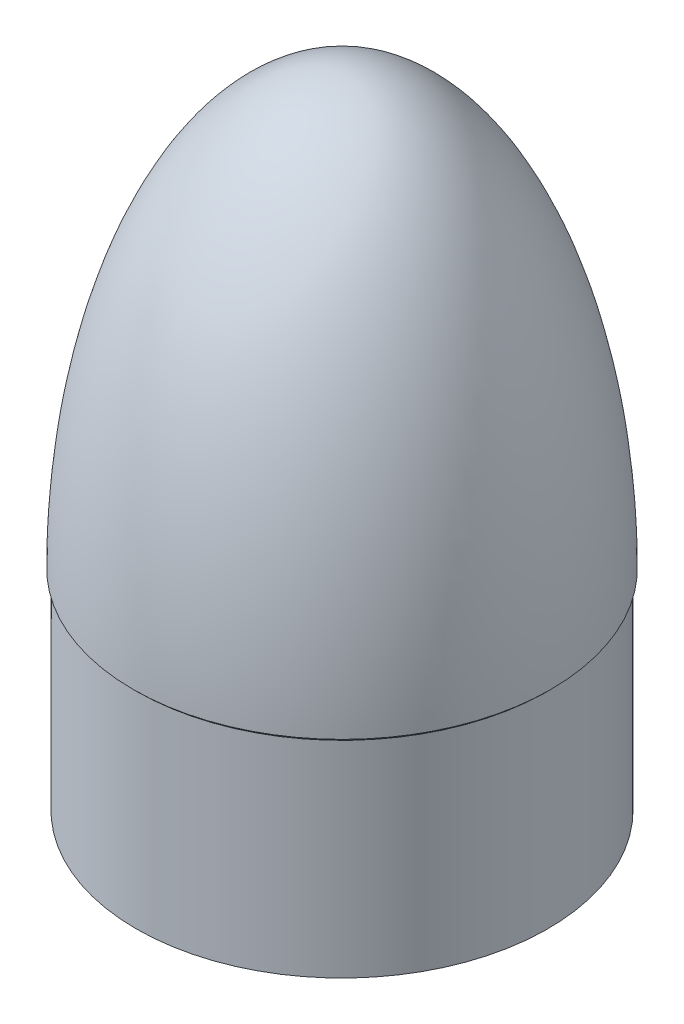
from build123d import *


with BuildPart() as part:
    # Sketch1 → Revolve1 (revolve)
    with BuildSketch(Plane.XY):
        with BuildLine():
            Line((0, 165.1), (0, 162.1028))
            add(Edge.make_bspline(
                [(77.467659031, 1.260181969), (76.870073544, 162.1028), (0, 162.1028)],
                knots=[4.720163027, 4.720163027, 4.720163027, 6.283185307, 6.283185307, 6.283185307], degree=2, weights=[1, 0.709849973, 1]))
            Line((77.467659031, 1.260181969), (76.3778, 0.170322938))
            Line((76.3778, 0.170322938), (76.3778, -80.518))
            Line((76.3778, -80.518), (79.375, -80.518))
            Line((79.375, -80.518), (79.375, -1.143))
            Line((79.375, -1.143), (80.518, 0))
            add(Edge.make_bspline(
                [(80.518, 0), (80.518, 165.1), (0, 165.1)],
                knots=[1.570796327, 1.570796327, 1.570796327, 3.141592654, 3.141592654, 3.141592654], degree=2, weights=[1, 0.707106781, 1]))
        make_face()
    revolve(axis=Axis((0, 165.1, 0), (0, -1, 0)))


solid = part.part
